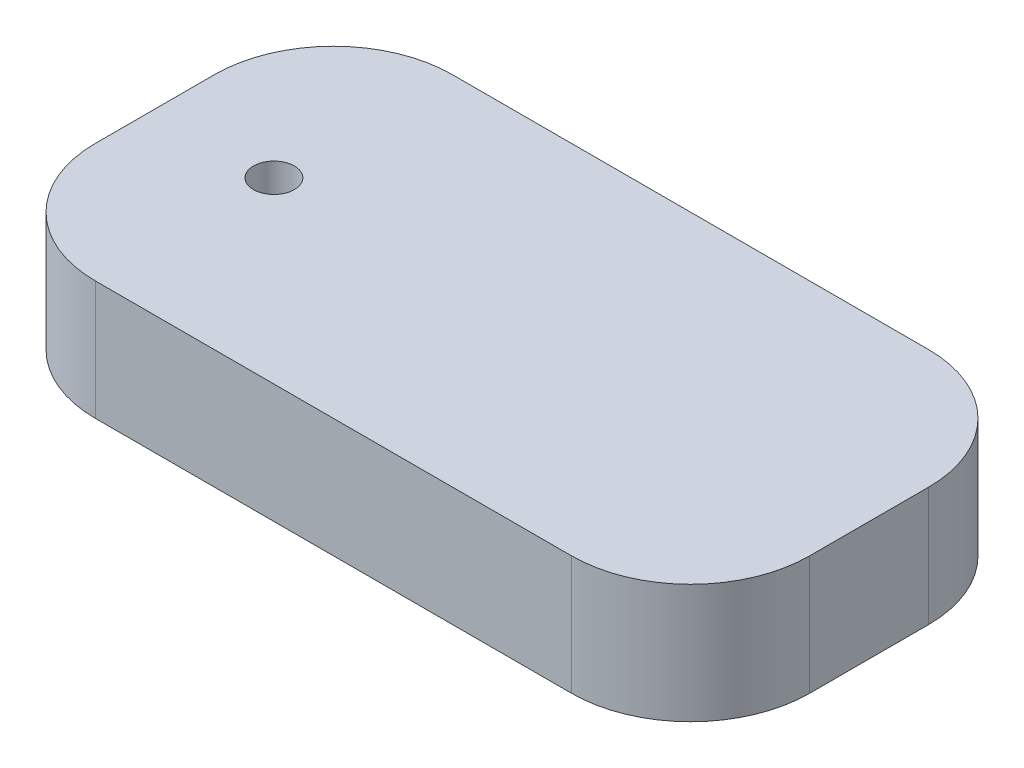
from build123d import *

# Parameters (mm, degrees)
SKETCH1_W           = 60
SKETCH1_H           = 30
BOSS_EXTRUDE1_DEPTH = 10
FILLET1_R           = 10
FILLET2_R           = 10
FILLET3_R           = 10
FILLET4_R           = 10
SKETCH3_R           = 1.720903767
CUT_EXTRUDE2_DEPTH  = 7


with BuildPart() as part:
    # Sketch1 → Boss-Extrude1 (new body)
    with BuildSketch(Plane(origin=(0, 0, 0), x_dir=(1, 0, 0), z_dir=(0, 1, 0))):
        with Locations((-2.582747066, 7.592753862)):
            Rectangle(SKETCH1_W, SKETCH1_H)
    extrude(amount=BOSS_EXTRUDE1_DEPTH)

    # Fillet1
    fillet1_edges = [part.edges().sort_by_distance(p)[0] for p in [
        (27.417252934, 5, 7.407246138),
    ]]
    fillet(fillet1_edges, radius=FILLET1_R)

    # Fillet2
    fillet2_edges = [part.edges().sort_by_distance(p)[0] for p in [
        (27.417252934, 5, -22.592753862),
    ]]
    fillet(fillet2_edges, radius=FILLET2_R)

    # Fillet3
    fillet3_edges = [part.edges().sort_by_distance(p)[0] for p in [
        (-32.582747066, 5, 7.407246138),
    ]]
    fillet(fillet3_edges, radius=FILLET3_R)

    # Fillet4
    fillet4_edges = [part.edges().sort_by_distance(p)[0] for p in [
        (-32.582747066, 5, -22.592753862),
    ]]
    fillet(fillet4_edges, radius=FILLET4_R)

    # Sketch3 → Cut-Extrude2 (cut)
    with BuildSketch(Plane(origin=(0, 10, 0), x_dir=(1, 0, 0), z_dir=(0, 1, 0))):
        with Locations((-22.582747066, 7.592753862)):
            Circle(SKETCH3_R)
    extrude(amount=-CUT_EXTRUDE2_DEPTH, mode=Mode.SUBTRACT)


solid = part.part
